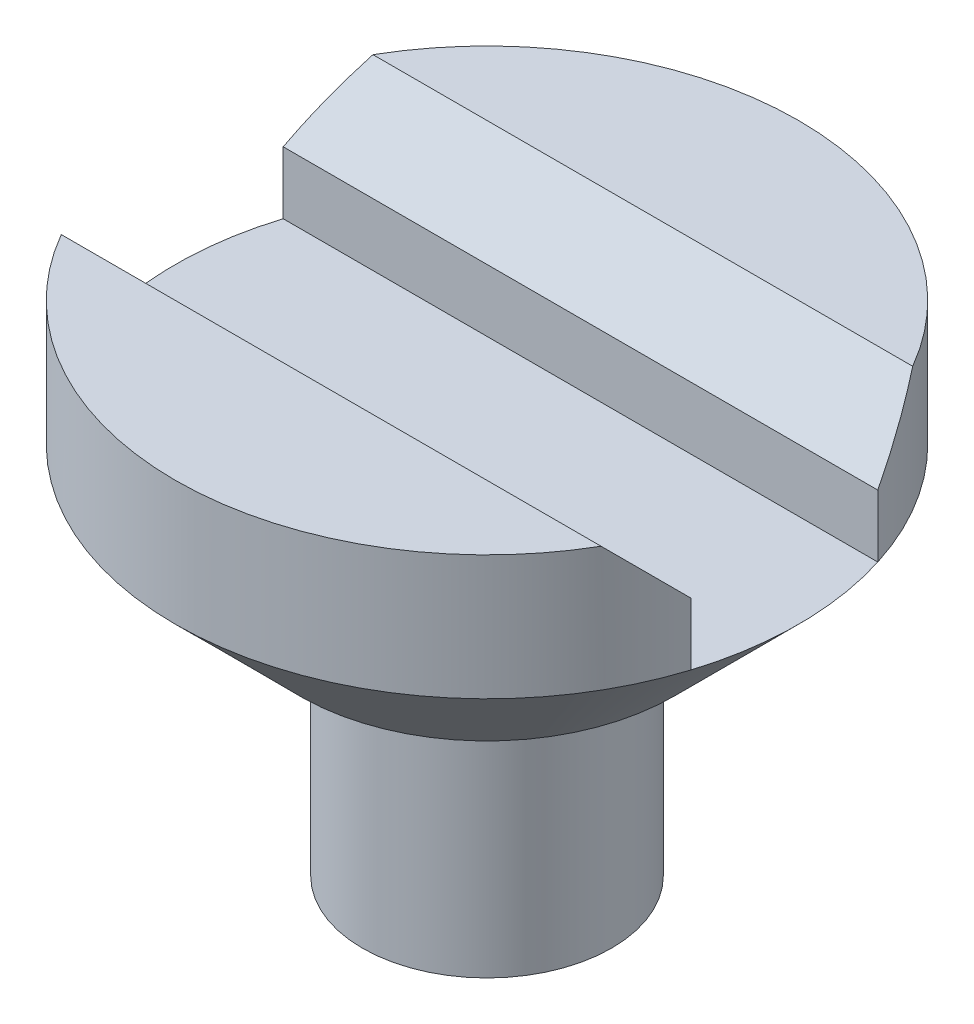
from build123d import *

# Parameters (mm, degrees)
SKETCH2_W          = 177.8
SKETCH2_H          = 38.1
CUT_EXTRUDE1_DEPTH = 25.4
CHAMFER1_SIZE      = 12.7
CHAMFER2_SIZE      = 25.4


with BuildPart() as part:
    # Sketch1 → Revolve1 (revolve)
    with BuildSketch(Plane.XY, mode=Mode.PRIVATE) as revolve1_sk:
        Polygon((0, 0), (0, 101.6), (63.5, 101.6), (63.5, 50.8), (25.4, 50.8), (25.4, 0), align=None)
    revolve(revolve1_sk.sketch.rotate(Axis((0, 0, 0), (0, 1, 0)), 90), axis=Axis((0, 0, 0), (0, 1, 0)))

    # Sketch2 → Cut-Extrude1 (cut)
    with BuildSketch(Plane(origin=(0, 101.6, 0), x_dir=(1, 0, 0), z_dir=(0, 1, 0))):
        Rectangle(SKETCH2_W, SKETCH2_H)
    extrude(amount=-CUT_EXTRUDE1_DEPTH, mode=Mode.SUBTRACT)

    # Chamfer1
    chamfer1_edges = [part.edges().sort_by_distance(p)[0] for p in [
        (0, 101.6, 19.05),
        (0, 101.6, -19.05),
    ]]
    chamfer(chamfer1_edges, length=CHAMFER1_SIZE)

    # Chamfer2
    chamfer2_edges = [part.edges().sort_by_distance(p)[0] for p in [
        (0, 50.8, 63.5),
    ]]
    chamfer(chamfer2_edges, length=CHAMFER2_SIZE - 0.0001)  # a hair under: the kernel refuses the full size


solid = part.part
